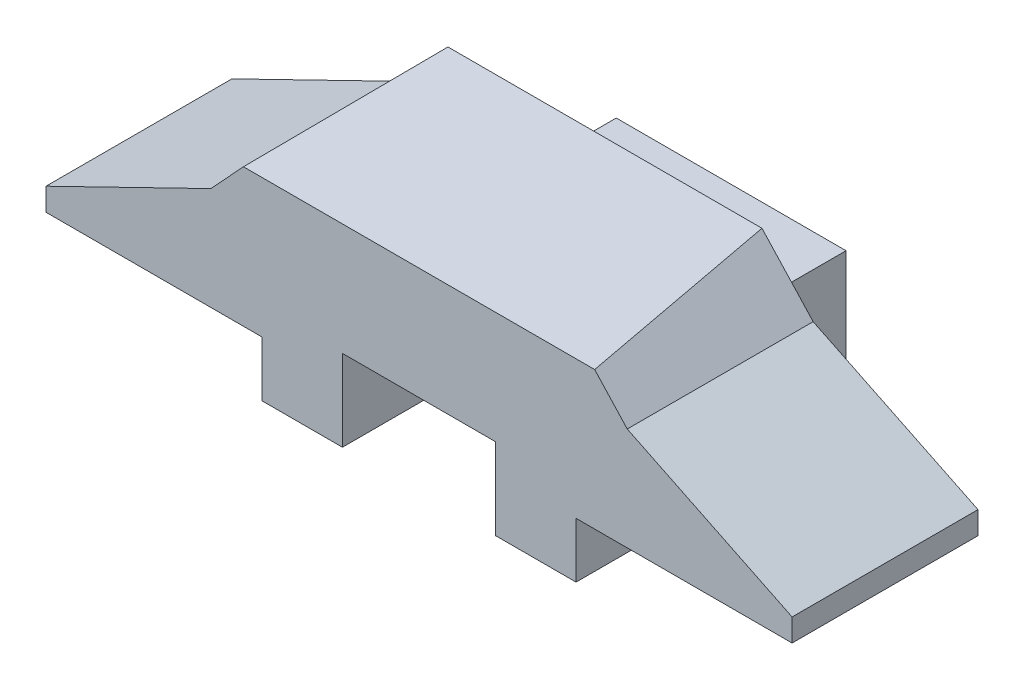
from build123d import *

# Parameters (mm, degrees)
BOSS_EXTRUDE1_DEPTH = 7.4
CUT_EXTRUDE1_DEPTH  = 31.916943618
CHAMFER1_SIZE       = 0.5
CHAMFER1_SIZE_2     = 8
BOSS_EXTRUDE2_DEPTH = 5.1
SKETCH8_W           = 2
SKETCH8_H           = 3.4
BOSS_EXTRUDE5_DEPTH = 1.2
CHAMFER2_SIZE       = 0.55
BOSS_EXTRUDE6_REACH = 19.155
SKETCH9_W           = 0.9
SKETCH9_H           = 3.093590623
SKETCH10_W          = 0.9
SKETCH10_H          = 3.309924143
BOSS_EXTRUDE7_DEPTH = 1
CHAMFER3_SIZE       = 3.5
CHAMFER3_SIZE_2     = 1


with BuildPart() as part:
    # Sketch1 → Boss-Extrude1 (new body)
    with BuildSketch(Plane.XY):
        Polygon((-6.25, 4.137675877), (6.25, 4.137675877), (8.287698915, 1.935907694), (14.849810865, -1.262324123), (14.849810865, -2.162324123), (6.250723489, -2.162324123), (6.25, -4.362324123), (3.05, -4.362324123), (3.05, -1.162324123), (-3.05, -1.162324123), (-3.05, -4.362324123), (-6.25, -4.362324123), (-6.25, -2.162324123), (-14.849810865, -2.162324123), (-14.849810865, -1.262324123), (-8.287698915, 1.935907694), align=None)
    extrude(amount=BOSS_EXTRUDE1_DEPTH)

    # Sketch3 → Cut-Extrude1 (cut, through all)
    with BuildSketch(Plane(origin=(14.849810865, 0, 0), x_dir=(0, 0, -1), z_dir=(1, 0, 0))):
        Polygon((-7.4, 3.337675877), (0, 4.137675877), (-7.4, 4.137675877), align=None)
    extrude(amount=-CUT_EXTRUDE1_DEPTH, mode=Mode.SUBTRACT)

    # Shell1: read off the stored shape, not the designer's step
    # Shell1: loft between two sections, ruled curve by curve
    shell1_from = [
        Edge.make_line((5.15, -1.062324123, 6.3), (11.928689782, -1.062324123, 6.3)),
        Edge.make_line((-11.928689782, -1.062324123, 6.3), (-5.15, -1.062324123, 6.3)),
        Edge.make_line((11.928689782, -1.062324123, 6.3), (7.620430834, 1.037428357, 6.3)),
        Edge.make_line((7.620430834, 1.037428357, 6.3), (6.405496555, 2.350185419, 6.3)),
        Edge.make_line((-6.405496555, 2.350185419, 6.3), (-7.620430834, 1.037428357, 6.3)),
        Edge.make_line((-7.620430834, 1.037428357, 6.3), (-11.928689782, -1.062324123, 6.3)),
        Edge.make_line((-5.15, -1.062324123, 6.3), (-5.15, -3.262324123, 6.3)),
        Edge.make_line((-5.15, -3.262324123, 6.3), (-4.15, -3.262324123, 6.3)),
        Edge.make_line((4.15, -3.262324123, 6.3), (5.15, -3.262324123, 6.3)),
        Edge.make_line((-4.15, -3.262324123, 6.3), (-4.15, -0.062324123, 6.3)),
        Edge.make_line((-4.15, -0.062324123, 6.3), (4.15, -0.062324123, 6.3)),
        Edge.make_line((4.15, -0.062324123, 6.3), (4.15, -3.262324123, 6.3)),
        Edge.make_line((5.15, -3.262324123, 6.3), (5.15, -1.062324123, 6.3)),
        Edge.make_line((6.405496555, 2.350185419, 6.3), (-6.405496555, 2.350185419, 6.3)),
    ]
    shell1_to = [
        Edge.make_line((5.15, -1.062324123, 0), (11.928689782, -1.062324123, 0)),
        Edge.make_line((-11.928689782, -1.062324123, 0), (-5.15, -1.062324123, 0)),
        Edge.make_line((11.928689782, -1.062324123, 0), (7.620430834, 1.037428357, 0)),
        Edge.make_line((7.620430834, 1.037428357, 0), (5.775167626, 3.0312665, 0)),
        Edge.make_line((-5.775167626, 3.0312665, 0), (-7.620430834, 1.037428357, 0)),
        Edge.make_line((-7.620430834, 1.037428357, 0), (-11.928689782, -1.062324123, 0)),
        Edge.make_line((-5.15, -1.062324123, 0), (-5.15, -3.262324123, 0)),
        Edge.make_line((-5.15, -3.262324123, 0), (-4.15, -3.262324123, 0)),
        Edge.make_line((4.15, -3.262324123, 0), (5.15, -3.262324123, 0)),
        Edge.make_line((-4.15, -3.262324123, 0), (-4.15, -0.062324123, 0)),
        Edge.make_line((-4.15, -0.062324123, 0), (4.15, -0.062324123, 0)),
        Edge.make_line((4.15, -0.062324123, 0), (4.15, -3.262324123, 0)),
        Edge.make_line((5.15, -3.262324123, 0), (5.15, -1.062324123, 0)),
        Edge.make_line((5.775167626, 3.0312665, 0), (-5.775167626, 3.0312665, 0)),
    ]
    shell1 = Solid(Shell([*[Face.make_surface_from_curves(shell1_from[k], shell1_to[k]) for k in range(14)], Face(Wire(shell1_from)), Face(Wire(shell1_to))]))
    add(shell1, mode=Mode.SUBTRACT)

    # Chamfer1
    # the kernel refuses this chamfer: 8, 0.5 mm, written as the material it takes off along each edge
    with BuildSketch(Plane(origin=(3.05, -1.162324123, 0), x_dir=(0, 1, 0), z_dir=(-1, 0, 0))) as chamfer1_piece_1:
        Polygon((CHAMFER1_SIZE, 0), (0, -CHAMFER1_SIZE_2), (0, 0), align=None)
    extrude(amount=6.1, mode=Mode.SUBTRACT)

    # Sketch7 → Boss-Extrude2 (add)
    with BuildSketch(Plane(origin=(0, 0, 0), x_dir=(-1, 0, 0), z_dir=(0, 0, -1))):
        Polygon((-3.05, -4.362324123), (-1.05, -4.362324123), (-1.05, -3.162324123), (-3.05, -3.162324123), (-3.05, -0.662324123), (3.05, -0.662324123), (3.05, -3.162324123), (1.05, -3.162324123), (1.05, -4.362324123), (3.05, -4.362324123), (4.65, -4.362324123), (4.65, -0.062324123), (-4.497528609, -0.062324123), (-4.497528609, -4.362324123), align=None)
    extrude(amount=BOSS_EXTRUDE2_DEPTH)

    # Sketch8 → Boss-Extrude5 (add)
    with BuildSketch(Plane(origin=(0, -4.362324123, 0), x_dir=(-1, 0, 0), z_dir=(0, -1, 0))):
        with Locations((-2.05, -1.7)):
            Rectangle(SKETCH8_W, SKETCH8_H)
        with Locations((2.05, -1.7)):
            Rectangle(SKETCH8_W, SKETCH8_H)
    extrude(amount=-BOSS_EXTRUDE5_DEPTH)

    # Chamfer2
    chamfer2_edges = [part.edges().sort_by_distance(p)[0] for p in [
        (1.05, -3.762324123, 3.4),
        (-1.05, -3.762324123, 3.4),
    ]]
    chamfer(chamfer2_edges, length=CHAMFER2_SIZE)

    # Sketch9 → Boss-Extrude6 (add, up to next)
    with BuildSketch(Plane(origin=(0, 0, 0), x_dir=(-1, 0, 0), z_dir=(0, 0, -1)), mode=Mode.PRIVATE) as boss_extrude6_sk1:
        with Locations((-2.288760134, 1.484471189)):
            Rectangle(SKETCH9_W, SKETCH9_H)
    boss_extrude6_tool1 = extrude(boss_extrude6_sk1.sketch, amount=-BOSS_EXTRUDE6_REACH, mode=Mode.PRIVATE) - part.part
    # Sketch9 → Boss-Extrude6 (add, up to next)
    with BuildSketch(Plane(origin=(0, 0, 0), x_dir=(-1, 0, 0), z_dir=(0, 0, -1)), mode=Mode.PRIVATE) as boss_extrude6_sk2:
        with Locations((2.288760134, 1.484471189)):
            Rectangle(SKETCH9_W, SKETCH9_H)
    boss_extrude6_tool2 = extrude(boss_extrude6_sk2.sketch, amount=-BOSS_EXTRUDE6_REACH, mode=Mode.PRIVATE) - part.part
    add(boss_extrude6_tool1.solids().sort_by_distance((2.28876, 1.484471, 0))[0])
    add(boss_extrude6_tool2.solids().sort_by_distance((-2.28876, 1.484471, 0))[0])

    # Sketch10 → Boss-Extrude7 (add)
    with BuildSketch(Plane(origin=(0, -0.062324123, 0), x_dir=(1, 0, 0), z_dir=(0, 1, 0))):
        with Locations((2.288760134, 1.654962072)):
            Rectangle(SKETCH10_W, SKETCH10_H)
        with Locations((-2.288760134, 1.654962072)):
            Rectangle(SKETCH10_W, SKETCH10_H)
    extrude(amount=BOSS_EXTRUDE7_DEPTH)

    # Chamfer3
    # the kernel refuses this chamfer: 3.5, 1 mm, written as the material it takes off along each edge
    with BuildSketch(Plane(origin=(-11.825802237, 0.937675877, -3.309924143), x_dir=(0, 0, 1), z_dir=(1, 0, 0))) as chamfer3_piece_1_section:
        Polygon((CHAMFER3_SIZE, 0), (0, CHAMFER3_SIZE_2), (0, 0), align=None)
    chamfer3_piece_1 = extrude(amount=19.074084206, mode=Mode.PRIVATE)
    chamfer3_piece_1 = split(chamfer3_piece_1, bisect_by=Plane(origin=(-11.825802237, 0.937675877, 0), z_dir=(0, 0, -1)), keep=Keep.TOP, mode=Mode.PRIVATE)
    chamfer3_piece_1 = split(chamfer3_piece_1, bisect_by=Plane(origin=(-11.825802237, -0.062324123, -3.309924143), z_dir=(0, 1, 0)), keep=Keep.TOP, mode=Mode.PRIVATE)
    add(chamfer3_piece_1, mode=Mode.SUBTRACT)
    with BuildSketch(Plane(origin=(-7.248281969, 0.937675877, -3.309924143), x_dir=(0, 0, 1), z_dir=(1, 0, 0))) as chamfer3_piece_2_section:
        Polygon((CHAMFER3_SIZE, 0), (0, CHAMFER3_SIZE_2), (0, 0), align=None)
    chamfer3_piece_2 = extrude(amount=19.074084206, mode=Mode.PRIVATE)
    chamfer3_piece_2 = split(chamfer3_piece_2, bisect_by=Plane(origin=(-7.248281969, 0.937675877, 0), z_dir=(0, 0, -1)), keep=Keep.TOP, mode=Mode.PRIVATE)
    chamfer3_piece_2 = split(chamfer3_piece_2, bisect_by=Plane(origin=(-7.248281969, -0.062324123, -3.309924143), z_dir=(0, 1, 0)), keep=Keep.TOP, mode=Mode.PRIVATE)
    add(chamfer3_piece_2, mode=Mode.SUBTRACT)


solid = part.part
